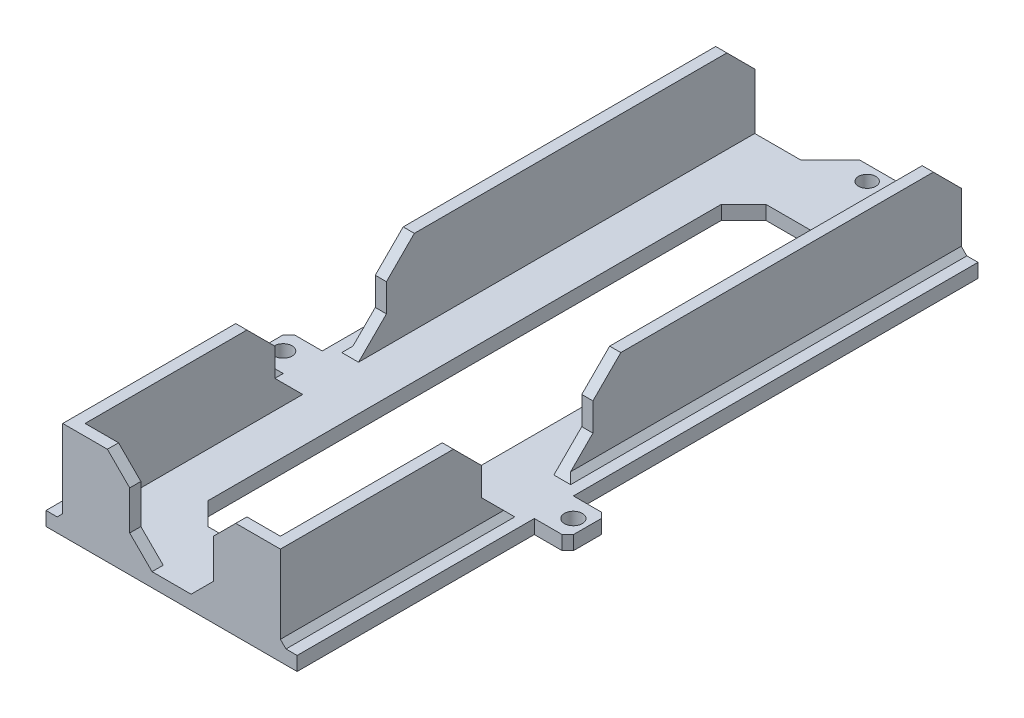
from build123d import *

# Parameters (mm, degrees)
SKETCH1_W                = 45
SKETCH1_H                = 122
BOSS_EXTRUDE1_DEPTH      = 2.5
SKETCH3_W                = 35
SKETCH3_H                = 2
BOSS_EXTRUDE2_DEPTH      = 15
SKETCH4_W                = 12
SKETCH4_H                = 7
BOSS_EXTRUDE3_DEPTH      = 2.5
SKETCH6_W                = 19
SKETCH6_H                = 100
CUT_EXTRUDE2_DEPTH       = 12.5
FILLET1_SIZE             = 4
SKETCH8_W                = 20
SKETCH8_H                = 15
CUT_EXTRUDE3_DEPTH       = 58.5
FILLET2_SIZE             = 5
SKETCH9_R                = 1.6
CUT_EXTRUDE4_DEPTH       = 58.5
BOSS_EXTRUDE4_DEPTH      = 2.5
BOSS_EXTRUDE4_DEPTH_BACK = 5
SKETCH10_W               = 8
SKETCH10_H               = 5.282493572
SKETCH10_R               = 1.55
BOSS_EXTRUDE5_DEPTH      = 8
BOSS_EXTRUDE6_DEPTH      = 2.5
FILLET3_SIZE             = 2.5
SKETCH13_W               = 15
SKETCH13_H               = 30
CUT_EXTRUDE5_DEPTH       = 6.5
FILLET4_SIZE             = 4
FILLET5_SIZE             = 1
FILLET7_SIZE             = 1


with BuildPart() as part:
    # Sketch1 → Boss-Extrude1 (new body)
    with BuildSketch(Plane(origin=(0, 0, 0), x_dir=(1, 0, 0), z_dir=(0, 1, 0))):
        with Locations((22.5, 61)):
            Rectangle(SKETCH1_W, SKETCH1_H)
    extrude(amount=BOSS_EXTRUDE1_DEPTH)

    # Sketch3 → Boss-Extrude2 (add)
    with BuildSketch(Plane(origin=(0, 2.5, 0), x_dir=(1, 0, 0), z_dir=(0, 1, 0))):
        Polygon((5, 122), (3, 122), (3, 0), (5, 0), (5, 2), align=None)
        with Locations((22.5, 1)):
            Rectangle(SKETCH3_W, SKETCH3_H)
        Polygon((40, 122), (40, 2), (40, 0), (42, 0), (42, 122), align=None)
    extrude(amount=BOSS_EXTRUDE2_DEPTH)

    # Sketch4 → Boss-Extrude3 (add)
    with BuildSketch(Plane(origin=(0, 0, 0), x_dir=(1, 0, 0), z_dir=(0, 1, 0))):
        with Locations((0, 46)):
            Rectangle(SKETCH4_W, SKETCH4_H)
        with Locations((45, 46)):
            Rectangle(SKETCH4_W, SKETCH4_H)
    extrude(amount=BOSS_EXTRUDE3_DEPTH)

    # Sketch6 → Cut-Extrude2 (cut)
    with BuildSketch(Plane(origin=(0, 2.5, 0), x_dir=(1, 0, 0), z_dir=(0, 1, 0))):
        with Locations((22.5, 62)):
            Rectangle(SKETCH6_W, SKETCH6_H)
    extrude(amount=-CUT_EXTRUDE2_DEPTH, mode=Mode.SUBTRACT)

    # Fillet1
    fillet1_edges = [part.edges().sort_by_distance(p)[0] for p in [
        (32, 1.25, -112),
        (32, 1.25, -12),
        (13, 1.25, -12),
        (13, 1.25, -112),
    ]]
    chamfer(fillet1_edges, length=FILLET1_SIZE)

    # Sketch8 → Cut-Extrude3 (cut)
    with BuildSketch(Plane(origin=(51, 0, 0), x_dir=(0, 0, -1), z_dir=(1, 0, 0))):
        with Locations((46, 10)):
            Rectangle(SKETCH8_W, SKETCH8_H)
    extrude(amount=-CUT_EXTRUDE3_DEPTH, mode=Mode.SUBTRACT)

    # Fillet2
    fillet2_edges = [part.edges().sort_by_distance(p)[0] for p in [
        (4, 17.5, -56),
        (41, 17.5, -56),
        (4, 2.5, -36),
        (41, 2.5, -36),
        (4, 17.5, -36),
        (41, 17.5, -36),
        (4, 2.5, -56),
        (41, 2.5, -56),
        (4, 17.5, -122),
        (41, 17.5, -122),
    ]]
    chamfer(fillet2_edges, length=FILLET2_SIZE)

    # Sketch9 → Cut-Extrude4 (cut)
    with BuildSketch(Plane.XZ):
        with Locations(Location((48.5, -46, 0), (0, 0, 270))):
            Circle(SKETCH9_R)
        with Locations(Location((-3.5, -46, 0), (0, 0, 270))):
            Circle(SKETCH9_R)
    extrude(amount=-CUT_EXTRUDE4_DEPTH, mode=Mode.SUBTRACT)



with BuildPart() as body_2:
    # Sketch10 → Boss-Extrude4 (new, two sides: drawn at the far end of the back side and taken through both)
    with BuildSketch(Plane(origin=(0, 0, 0), x_dir=(1, 0, 0), z_dir=(0, 1, 0)).offset(-BOSS_EXTRUDE4_DEPTH_BACK)):
        with Locations((22.5, 124.641246786)):
            Rectangle(SKETCH10_W, SKETCH10_H)
        with Locations(Location((22.5, 124.641246786, 0), (0, 0, 270))):
            Circle(SKETCH10_R, mode=Mode.SUBTRACT)
    extrude(amount=BOSS_EXTRUDE4_DEPTH + BOSS_EXTRUDE4_DEPTH_BACK)


with BuildPart() as part_1:
    add(part.part)

    add(body_2.part)  # Boss-Extrude5 merges body 2
    # Sketch11 → Boss-Extrude5 (add)
    with BuildSketch(Plane.ZY.offset(-18.5)):
        Polygon((-119.5, 0), (-122.028446462, -2.5), (-122, 0), align=None)
    extrude(amount=-BOSS_EXTRUDE5_DEPTH)

    # Sketch12 → Boss-Extrude6 (add)
    with BuildSketch(Plane(origin=(0, 2.5, 0), x_dir=(1, 0, 0), z_dir=(0, 1, 0))):
        Polygon((18.5, 127.282493572), (18.5, 122), (13.22, 122), align=None)
        Polygon((26.5, 122), (31.78, 122), (26.5, 127.282493572), align=None)
    extrude(amount=-BOSS_EXTRUDE6_DEPTH)

    # Fillet3
    # the kernel refuses this chamfer: 2.5 mm, written as the material it adds along each edge
    with BuildSketch(Plane(origin=(26.5, 0, -113.07079253), x_dir=(0.9996219169112968, 0.027495876610586372, 0), z_dir=(0, 0, -1))) as fillet3_piece_1_section:
        Polygon((FILLET3_SIZE * 0.999621916911, FILLET3_SIZE * 0.0274958766106), (-FILLET3_SIZE * 0.0274958766106, FILLET3_SIZE * 0.999621916911), (0, 0), align=None)
    fillet3_piece_1 = extrude(amount=14.211701041, mode=Mode.PRIVATE)
    fillet3_piece_1 = split(fillet3_piece_1, bisect_by=Plane(origin=(26.425464868, -2.516462273, -122.045096052), z_dir=(0, -0.7110955817269744, 0.7030953517470985)), keep=Keep.TOP, mode=Mode.PRIVATE)
    fillet3_piece_1 = split(fillet3_piece_1, bisect_by=Plane(origin=(26.425464868, -2.531550229, -122), z_dir=(0, 0, -1)), keep=Keep.TOP, mode=Mode.PRIVATE)
    add(fillet3_piece_1)
    with BuildSketch(Plane(origin=(26.5, 0, -113.07079253), x_dir=(0.9996219169112968, 0.027495876610586372, 0), z_dir=(0, 0, -1))) as fillet3_piece_2_section:
        Polygon((FILLET3_SIZE * 0.999621916911, FILLET3_SIZE * 0.0274958766106), (-FILLET3_SIZE * 0.0274958766106, FILLET3_SIZE * 0.999621916911), (0, 0), align=None)
    fillet3_piece_2 = extrude(amount=14.211701041, mode=Mode.PRIVATE)
    fillet3_piece_2 = split(fillet3_piece_2, bisect_by=Plane(origin=(27.453210407, -1.061082343, -120.573155958), z_dir=(0, 0.7110955817269744, -0.7030953517470985)), keep=Keep.TOP, mode=Mode.PRIVATE)
    fillet3_piece_2 = split(fillet3_piece_2, bisect_by=Plane(origin=(27.453210407, -0.58369775, -122), z_dir=(0, 0, 1)), keep=Keep.TOP, mode=Mode.PRIVATE)
    add(fillet3_piece_2)
    with BuildSketch(Plane(origin=(26.5, 0, -113.07079253), x_dir=(0.9996219169112968, 0.027495876610586372, 0), z_dir=(0, 0, -1))) as fillet3_piece_3_section:
        Polygon((FILLET3_SIZE * 0.999621916911, FILLET3_SIZE * 0.0274958766106), (-FILLET3_SIZE * 0.0274958766106, FILLET3_SIZE * 0.999621916911), (0, 0), align=None)
    fillet3_piece_3 = extrude(amount=14.211701041, mode=Mode.PRIVATE)
    fillet3_piece_3 = split(fillet3_piece_3, bisect_by=Plane(origin=(27.235712014, -2.816950005, -122.349002909), z_dir=(0, 0.7110955817269744, -0.7030953517470985)), keep=Keep.TOP, mode=Mode.PRIVATE)
    fillet3_piece_3 = split(fillet3_piece_3, bisect_by=Plane(origin=(28.372764332, -0.871738969, -125.408844794), z_dir=(-0.7072736937748051, 0, 0.7069398291892623)), keep=Keep.TOP, mode=Mode.PRIVATE)
    fillet3_piece_3 = split(fillet3_piece_3, bisect_by=Plane(origin=(27.235712014, -0.871738969, -122), z_dir=(0, 0, -1)), keep=Keep.TOP, mode=Mode.PRIVATE)
    add(fillet3_piece_3)
    with BuildSketch(Plane(origin=(18.5, 0, -127.282493572), x_dir=(0.027495876610586317, -0.9996219169112968, 0), z_dir=(0, 0, 1))) as fillet3_piece_4_section:
        Polygon((FILLET3_SIZE * 0.999621916911, -FILLET3_SIZE * 0.0274958766106), (-FILLET3_SIZE * 0.0274958766106, -FILLET3_SIZE * 0.999621916911), (0, 0), align=None)
    fillet3_piece_4 = extrude(amount=14.211701041, mode=Mode.PRIVATE)
    fillet3_piece_4 = split(fillet3_piece_4, bisect_by=Plane(origin=(17.764287986, -2.816950005, -122.349002909), z_dir=(0, 0.7110955817269744, -0.7030953517470985)), keep=Keep.TOP, mode=Mode.PRIVATE)
    fillet3_piece_4 = split(fillet3_piece_4, bisect_by=Plane(origin=(17.764287986, -0.871738969, -122), z_dir=(0, 0, -1)), keep=Keep.TOP, mode=Mode.PRIVATE)
    fillet3_piece_4 = split(fillet3_piece_4, bisect_by=Plane(origin=(16.627235668, -0.871738969, -125.408844794), z_dir=(0.7072736937748045, 0, 0.7069398291892628)), keep=Keep.TOP, mode=Mode.PRIVATE)
    add(fillet3_piece_4)
    with BuildSketch(Plane(origin=(18.5, 0, -127.282493572), x_dir=(0.027495876610586317, -0.9996219169112968, 0), z_dir=(0, 0, 1))) as fillet3_piece_5_section:
        Polygon((FILLET3_SIZE * 0.999621916911, -FILLET3_SIZE * 0.0274958766106), (-FILLET3_SIZE * 0.0274958766106, -FILLET3_SIZE * 0.999621916911), (0, 0), align=None)
    fillet3_piece_5 = extrude(amount=14.211701041, mode=Mode.PRIVATE)
    fillet3_piece_5 = split(fillet3_piece_5, bisect_by=Plane(origin=(17.546789593, -1.061082343, -120.573155958), z_dir=(0, 0.7110955817269744, -0.7030953517470985)), keep=Keep.TOP, mode=Mode.PRIVATE)
    fillet3_piece_5 = split(fillet3_piece_5, bisect_by=Plane(origin=(17.546789593, -0.58369775, -122), z_dir=(0, 0, 1)), keep=Keep.TOP, mode=Mode.PRIVATE)
    add(fillet3_piece_5)
    with BuildSketch(Plane(origin=(18.5, 0, -127.282493572), x_dir=(0.027495876610586317, -0.9996219169112968, 0), z_dir=(0, 0, 1))) as fillet3_piece_6_section:
        Polygon((FILLET3_SIZE * 0.999621916911, -FILLET3_SIZE * 0.0274958766106), (-FILLET3_SIZE * 0.0274958766106, -FILLET3_SIZE * 0.999621916911), (0, 0), align=None)
    fillet3_piece_6 = extrude(amount=14.211701041, mode=Mode.PRIVATE)
    fillet3_piece_6 = split(fillet3_piece_6, bisect_by=Plane(origin=(18.574535132, -2.516462273, -122.045096052), z_dir=(0, -0.7110955817269744, 0.7030953517470985)), keep=Keep.TOP, mode=Mode.PRIVATE)
    fillet3_piece_6 = split(fillet3_piece_6, bisect_by=Plane(origin=(18.574535132, -2.531550229, -122), z_dir=(0, 0, -1)), keep=Keep.TOP, mode=Mode.PRIVATE)
    add(fillet3_piece_6)

    # Sketch13 → Cut-Extrude5 (cut)
    with BuildSketch(Plane.XY):
        with Locations((22.5, 17.5)):
            Rectangle(SKETCH13_W, SKETCH13_H)
    extrude(amount=-CUT_EXTRUDE5_DEPTH, mode=Mode.SUBTRACT)

    # Fillet4
    fillet4_edges = [part_1.edges().sort_by_distance(p)[0] for p in [
        (30, 17.5, -1),
        (15, 17.5, -1),
        (30, 2.5, -1),
        (15, 2.5, -1),
    ]]
    chamfer(fillet4_edges, length=FILLET4_SIZE)

    # Fillet5
    fillet5_edges = [part_1.edges().sort_by_distance(p)[0] for p in [
        (42, 2.5, -20.5),
        (3, 2.5, -20.5),
        (3, 2.5, -86.5),
        (42, 2.5, -86.5),
    ]]
    chamfer(fillet5_edges, length=FILLET5_SIZE)

    # Fillet7
    fillet7_edges = [part_1.edges().sort_by_distance(p)[0] for p in [
        (-6, 1.25, -42.5),
        (-6, 1.25, -49.5),
        (51, 1.25, -49.5),
        (51, 1.25, -42.5),
    ]]
    chamfer(fillet7_edges, length=FILLET7_SIZE)


solid = part_1.part
